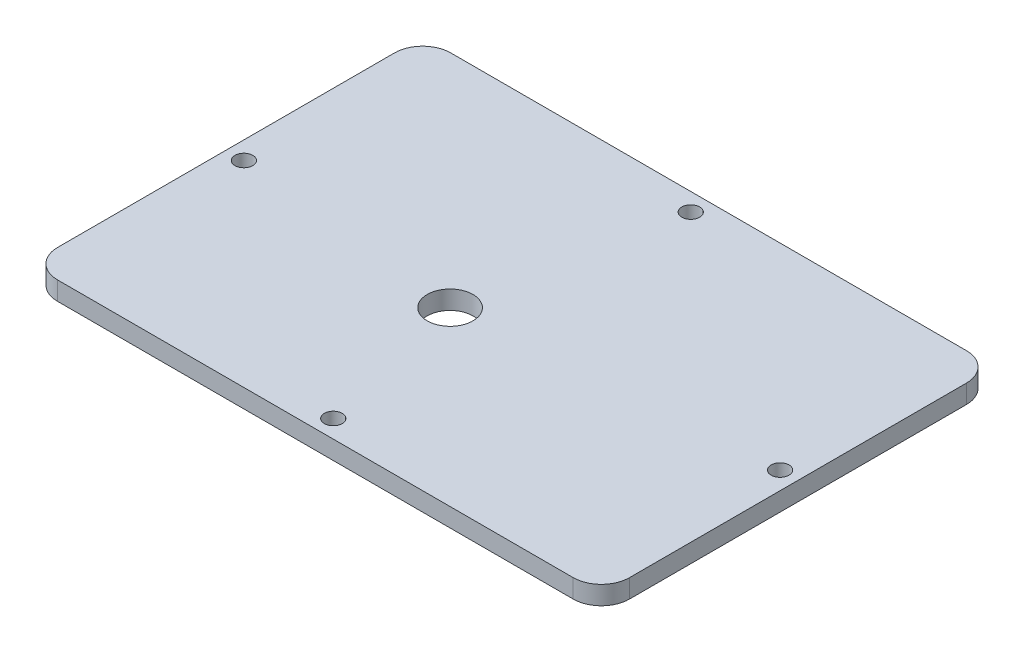
from build123d import *

# Parameters (mm, degrees)
SKETCH1_W           = 101.6
SKETCH1_H           = 69.85
BOSS_EXTRUDE1_DEPTH = 3.302
SKETCH4_R           = 1.5875
CUT_EXTRUDE1_DEPTH  = 62.735717611
FILLET1_R           = 5
SKETCH5_R           = 4.064
CUT_EXTRUDE2_DEPTH  = 62.735717611


with BuildPart() as part:
    # Sketch1 → Boss-Extrude1 (new body)
    with BuildSketch(Plane(origin=(0, 0, 0), x_dir=(1, 0, 0), z_dir=(0, 1, 0))):
        Rectangle(SKETCH1_W, SKETCH1_H)
    extrude(amount=BOSS_EXTRUDE1_DEPTH)

    # Sketch4 → Cut-Extrude1 (cut, through all)
    with BuildSketch(Plane(origin=(0, 0, 0), x_dir=(-1, 0, 0), z_dir=(0, -1, 0))):
        with Locations((0, 31.75)):
            Circle(SKETCH4_R)
        with Locations((-47.625, 0)):
            Circle(SKETCH4_R)
        with Locations((0, -31.75)):
            Circle(SKETCH4_R)
        with Locations((47.625, 0)):
            Circle(SKETCH4_R)
    extrude(amount=-CUT_EXTRUDE1_DEPTH, mode=Mode.SUBTRACT)

    # Fillet1
    fillet1_edges = [part.edges().sort_by_distance(p)[0] for p in [
        (50.8, 1.651, -34.925),
        (50.8, 1.651, 34.925),
        (-50.8, 1.651, 34.925),
        (-50.8, 1.651, -34.925),
    ]]
    fillet(fillet1_edges, radius=FILLET1_R)

    # Sketch5 → Cut-Extrude2 (cut, through all)
    with BuildSketch(Plane(origin=(0, 3.302, 0), x_dir=(1, 0, 0), z_dir=(0, 1, 0))):
        with Locations((-6.671406789, -4.328326436)):
            Circle(SKETCH5_R)
    extrude(amount=-CUT_EXTRUDE2_DEPTH, mode=Mode.SUBTRACT)


solid = part.part
